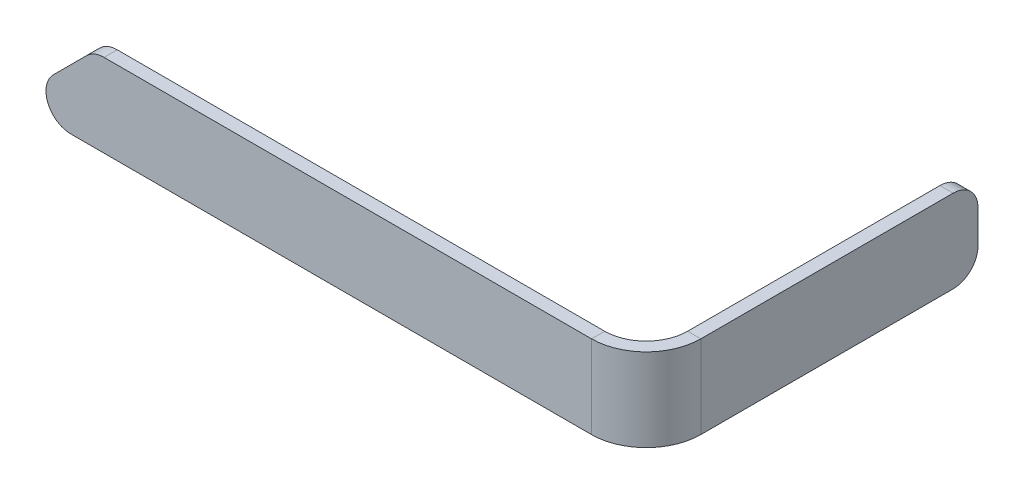
from build123d import *

# Parameters (mm, degrees)
SKETCH1_W                    = 75
SKETCH1_H                    = 10
BOSS_EXTRUDE1_DEPTH          = 1.6
CUT_EXTRUDE1_DEPTH           = 38.865683673
CUT_EXTRUDE1_DEPTH_BACK      = 10
CONVERT_SOLID1_DEPTH         = 0.0125
EDGE_FLANGE1_STRIP_W         = 16.35
EDGE_FLANGE1_STRIP_H         = 1.5875
EDGE_FLANGE1_STRIP_CUT_DEPTH = 10
EDGE_FLANGE1_DEPTH           = 10
FILLET1_R                    = 3


# Read off the part's stored shape, not the designer's step: Convert-Solid1
# Sheet-metal steps are written as plain solids
with BuildPart() as part:
    # Sketch1 → Boss-Extrude1 (new body)
    with BuildSketch(Plane.XY):
        Rectangle(SKETCH1_W, SKETCH1_H)
    extrude(amount=BOSS_EXTRUDE1_DEPTH)

    # Sketch2 → Cut-Extrude1 (cut, two sides: drawn at the far end of the back side and taken through both)
    with BuildSketch(Plane.XY.offset(1.6).offset(-CUT_EXTRUDE1_DEPTH_BACK)):
        Polygon((-37.5, 5), (-37.5, -5), (-27.5, 5), align=None)
    extrude(amount=CUT_EXTRUDE1_DEPTH + CUT_EXTRUDE1_DEPTH_BACK, mode=Mode.SUBTRACT)

    # Convert-Solid1 outline → Convert-Solid1 (cut)
    with BuildSketch(Plane.XY):
        Polygon((37.5, -5), (37.5, 5), (-27.5, 5), (-37.5, -5), align=None)
    extrude(amount=CONVERT_SOLID1_DEPTH, mode=Mode.SUBTRACT)

    # Edge-Flange1 strip (across the edge) → Edge-Flange1 strip cut (cut)
    with BuildSketch(Plane(origin=(37.5, 5, 0.0125), x_dir=(-1, 0, 0), z_dir=(0, -1, 0))):
        with Locations((-3.175, -0.79375)):
            Rectangle(EDGE_FLANGE1_STRIP_W, EDGE_FLANGE1_STRIP_H)
    extrude(amount=EDGE_FLANGE1_STRIP_CUT_DEPTH, mode=Mode.SUBTRACT)

    # Edge-Flange1 section (across the edge) → Edge-Flange1 (add)
    with BuildSketch(Plane(origin=(37.5, 5, 0.0125), x_dir=(-1, 0, 0), z_dir=(0, -1, 0))):
        with BuildLine():
            Line((-1.5875, 5), (-1.5875, 38.4125))
            Line((-1.5875, 38.4125), (0, 38.4125))
            Line((0, 38.4125), (0, 5))
            ThreePointArc((0, 5), (1.464466094, 1.464466094), (5, 0))
            Line((5, 0), (5, -1.5875))
            ThreePointArc((5, -1.5875), (0.341934079, 0.341934079), (-1.5875, 5))
        make_face()
    extrude(amount=EDGE_FLANGE1_DEPTH)

    # Fillet1
    fillet1_edges = [part.edges().sort_by_distance(p)[0] for p in [
        (38.29375, 5, -38.4),
        (38.29375, -5, -38.4),
        (-37.5, -5, 0.80625),
        (-27.5, 5, 0.80625),
    ]]
    fillet(fillet1_edges, radius=FILLET1_R)


solid = part.part
